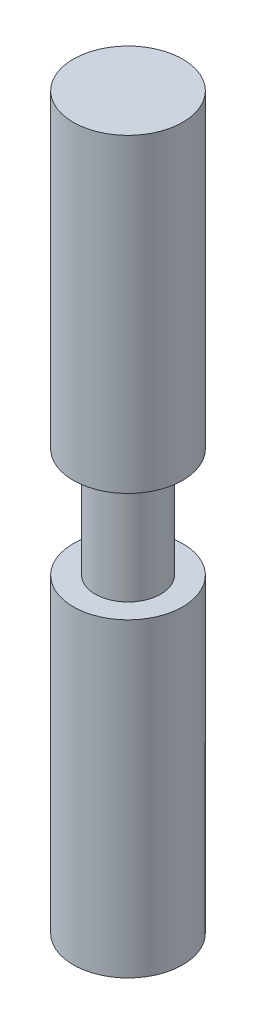
from build123d import *

# Parameters (mm, degrees)
SKETCH1_R           = 5.715
BOSS_EXTRUDE1_DEPTH = 19.05
SKETCH2_R           = 9.525
BOSS_EXTRUDE2_DEPTH = 53.975
BOSS_EXTRUDE3_START = 53.975
SKETCH3_R           = 9.525
BOSS_EXTRUDE3_DEPTH = 53.975


with BuildPart() as part:
    # Sketch1 → Boss-Extrude1 (new body)
    with BuildSketch(Plane(origin=(0, 0, 0), x_dir=(1, 0, 0), z_dir=(0, 1, 0))):
        Circle(SKETCH1_R)
    extrude(amount=BOSS_EXTRUDE1_DEPTH)

    # Sketch2 → Boss-Extrude2 (add)
    with BuildSketch(Plane(origin=(0, 19.05, 0), x_dir=(1, 0, 0), z_dir=(0, 1, 0))):
        Circle(SKETCH2_R)
    extrude(amount=BOSS_EXTRUDE2_DEPTH)

    # Sketch3 → Boss-Extrude3 (add)
    with BuildSketch(Plane.XZ.offset(BOSS_EXTRUDE3_START)):
        Circle(SKETCH3_R)
    extrude(amount=-BOSS_EXTRUDE3_DEPTH)


solid = part.part
